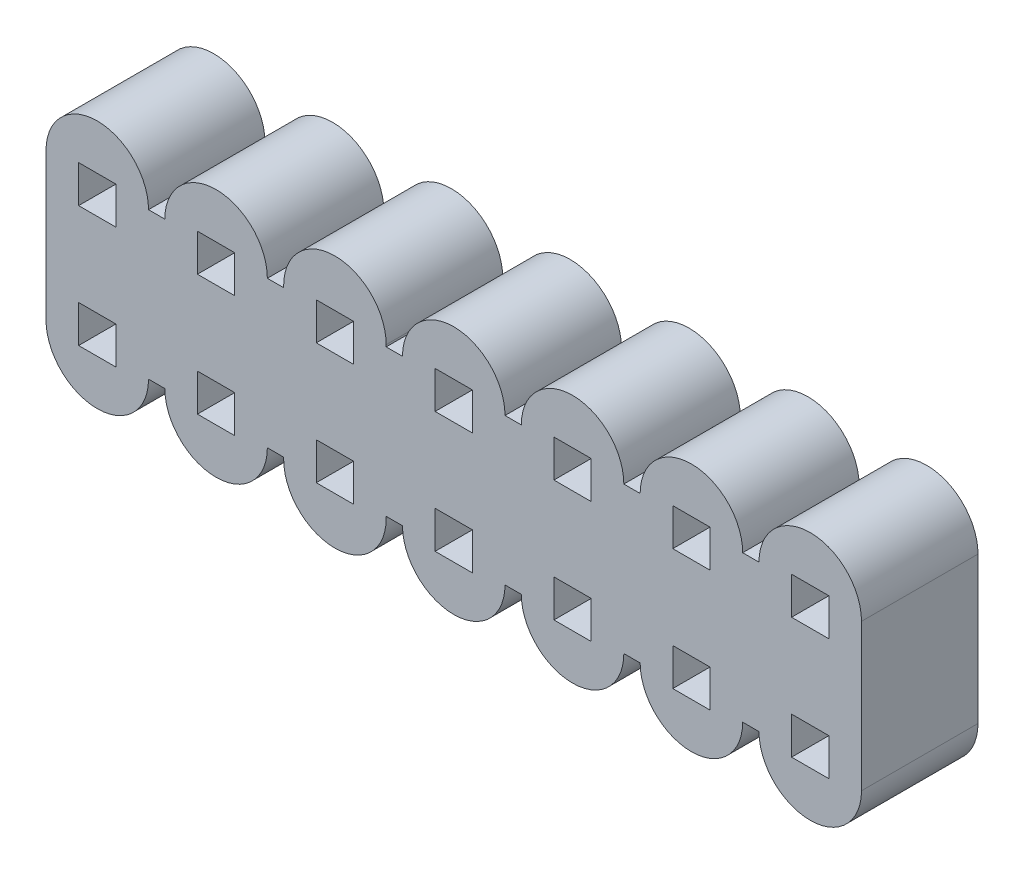
from build123d import *

# Parameters (mm, degrees)
P_IDAT_VYSUNUT_M2_DEPTH  = 2.5
SKICA3_W                 = 0.8
SKICA3_H                 = 0.8
ODEBRAT_VYSUNUT_M1_DEPTH = 2.5


# Read off the part's stored shape, not the designer's step: Přidat vysunutím2
with BuildPart() as part:
    # Přidat vysunutím2 outline → Přidat vysunutím2 (new body)
    with BuildSketch(Plane.XY):
        with BuildLine():
            Line((2.40336004, -19.590083306), (2.40336004, -16.441317707))
            ThreePointArc((2.40336004, -16.441317707), (1.30336004, -15.341317707), (0.20336004, -16.441317707))
            Line((0.20336004, -16.441317707), (-0.14663996, -16.441317707))
            ThreePointArc((-0.14663996, -16.441317707), (-1.24602276, -15.34131788), (-2.346639267, -16.440083307))
            Line((-2.346639267, -16.440083307), (-2.696640653, -16.440083307))
            ThreePointArc((-2.696640653, -16.440083307), (-3.79725716, -15.34131788), (-4.89663996, -16.441317707))
            Line((-4.89663996, -16.441317707), (-5.24663996, -16.441317707))
            ThreePointArc((-5.24663996, -16.441317707), (-6.34663996, -15.341317707), (-7.44663996, -16.441317707))
            Line((-7.44663996, -16.441317707), (-7.79663996, -16.441317707))
            Line((-7.79663996, -16.441317707), (-7.79663996, -16.399925636))
            ThreePointArc((-7.79663996, -16.399925636), (-8.89663996, -15.299925636), (-9.99663996, -16.399925636))
            Line((-9.99663996, -16.399925636), (-9.99663996, -16.441317707))
            Line((-9.99663996, -16.441317707), (-10.34663996, -16.441317707))
            ThreePointArc((-10.34663996, -16.441317707), (-11.44663996, -15.341317707), (-12.54663996, -16.441317707))
            Line((-12.54663996, -16.441317707), (-12.89663996, -16.441317707))
            ThreePointArc((-12.89663996, -16.441317707), (-13.99663996, -15.341317707), (-15.09663996, -16.441317707))
            Line((-15.09663996, -16.441317707), (-15.09663996, -19.590083306))
            ThreePointArc((-15.09663996, -19.590083306), (-13.99663996, -20.690083306), (-12.89663996, -19.590083306))
            Line((-12.89663996, -19.590083306), (-12.54663996, -19.590083306))
            ThreePointArc((-12.54663996, -19.590083306), (-11.44663996, -20.690083306), (-10.34663996, -19.590083306))
            Line((-10.34663996, -19.590083306), (-9.99663996, -19.590083306))
            Line((-9.99663996, -19.590083306), (-9.99663996, -19.631475378))
            ThreePointArc((-9.99663996, -19.631475378), (-8.89663996, -20.731475378), (-7.79663996, -19.631475378))
            Line((-7.79663996, -19.631475378), (-7.79663996, -19.590083306))
            Line((-7.79663996, -19.590083306), (-7.44663996, -19.590083306))
            ThreePointArc((-7.44663996, -19.590083306), (-6.34663996, -20.690083306), (-5.24663996, -19.590083306))
            Line((-5.24663996, -19.590083306), (-4.89663996, -19.590083306))
            ThreePointArc((-4.89663996, -19.590083306), (-3.79663996, -20.690083306), (-2.69663996, -19.590083306))
            Line((-2.69663996, -19.590083306), (-2.34663996, -19.590083306))
            ThreePointArc((-2.34663996, -19.590083306), (-1.24663996, -20.690083306), (-0.14663996, -19.590083306))
            Line((-0.14663996, -19.590083306), (0.20336004, -19.590083306))
            ThreePointArc((0.20336004, -19.590083306), (1.30336004, -20.690083306), (2.40336004, -19.590083306))
        make_face()
    extrude(amount=P_IDAT_VYSUNUT_M2_DEPTH)

    # Skica3 → Odebrat vysunutím1 (cut)
    with BuildSketch(Plane.XY.offset(2.5)):
        with Locations((-13.99663996, -16.715700507)):
            Rectangle(SKICA3_W, SKICA3_H)
        with Locations((-13.99663996, -19.315700507)):
            Rectangle(SKICA3_W, SKICA3_H)
        with Locations((-8.89663996, -16.715700507)):
            Rectangle(SKICA3_W, SKICA3_H)
        with Locations((-11.44663996, -16.715700507)):
            Rectangle(SKICA3_W, SKICA3_H)
        with Locations((-11.44663996, -19.315700507)):
            Rectangle(SKICA3_W, SKICA3_H)
        with Locations((-8.89663996, -19.315700507)):
            Rectangle(SKICA3_W, SKICA3_H)
        with Locations((-6.34663996, -16.715700507)):
            Rectangle(SKICA3_W, SKICA3_H)
        with Locations((-6.34663996, -19.315700507)):
            Rectangle(SKICA3_W, SKICA3_H)
        with Locations((-3.79663996, -16.715700507)):
            Rectangle(SKICA3_W, SKICA3_H)
        with Locations((-3.79663996, -19.315700507)):
            Rectangle(SKICA3_W, SKICA3_H)
        with Locations((-1.24663996, -16.715700507)):
            Rectangle(SKICA3_W, SKICA3_H)
        with Locations((-1.24663996, -19.315700507)):
            Rectangle(SKICA3_W, SKICA3_H)
        with Locations((1.30336004, -16.715700507)):
            Rectangle(SKICA3_W, SKICA3_H)
        with Locations((1.30336004, -19.315700507)):
            Rectangle(SKICA3_W, SKICA3_H)
    extrude(amount=-ODEBRAT_VYSUNUT_M1_DEPTH, mode=Mode.SUBTRACT)


solid = part.part
